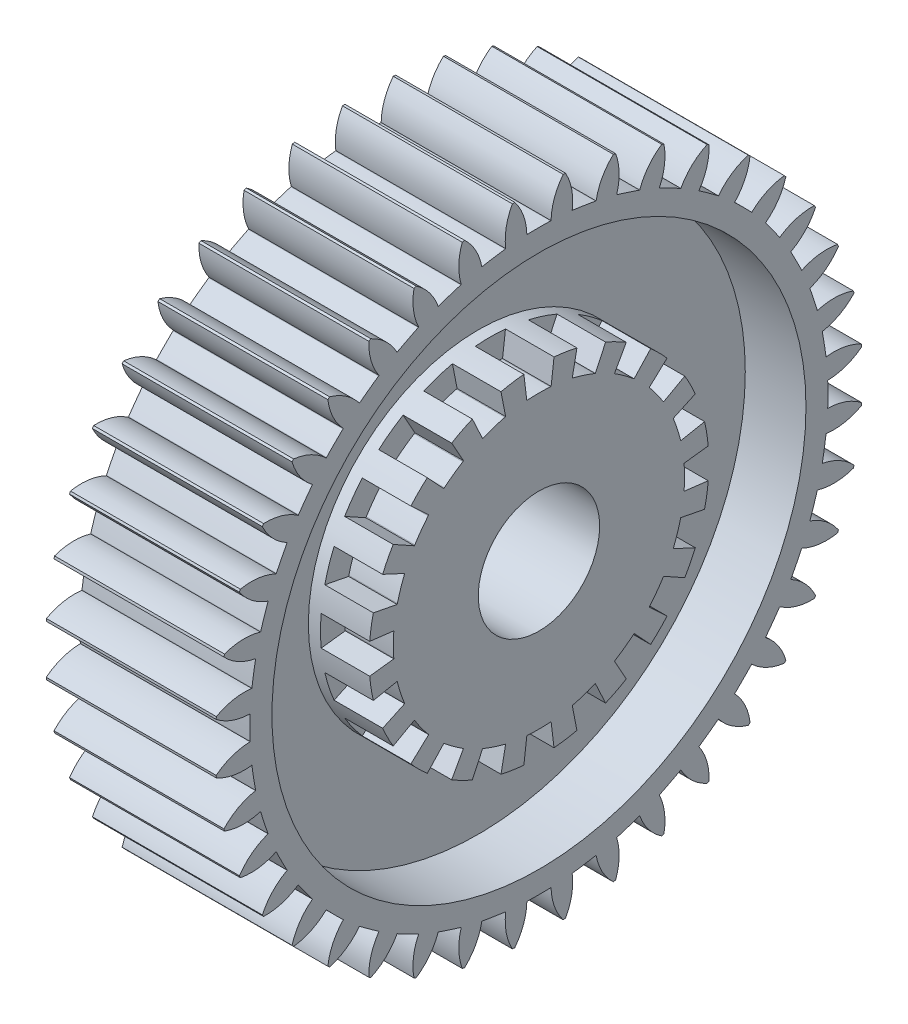
from build123d import *

# Parameters (mm, degrees)
SKETCH1_R                = 133.35
BOSS_EXTRUDE1_DEPTH      = 35
SKETCH2_R                = 25
CUT_EXTRUDE1_DEPTH       = 202.157761471
SKETCH3_R                = 110
SKETCH3_R_2              = 70
CUT_EXTRUDE2_DEPTH       = 25
CUT_EXTRUDE5_DEPTH       = 202.157761471
FILLET1_R                = 230
CIRPATTERN1_COUNT        = 40
FILLET1_OF_CIRPATTERN1_R = 230
CUT_EXTRUDE6_DEPTH       = 20
FILLET2_R                = 70
CIRPATTERN2_COUNT        = 20
FILLET2_OF_CIRPATTERN2_R = 70


with BuildPart() as part:
    # Sketch1 → Boss-Extrude1 (new, symmetric)
    with BuildSketch(Plane(origin=(0, 0, 0), x_dir=(0, 0, -1), z_dir=(1, 0, 0))):
        Circle(SKETCH1_R)
    extrude(amount=BOSS_EXTRUDE1_DEPTH, both=True)

    # Sketch2 → Cut-Extrude1 (cut, through all)
    with BuildSketch(Plane(origin=(35, 0, 0), x_dir=(0, 0, -1), z_dir=(1, 0, 0))):
        Circle(SKETCH2_R)
    extrude(amount=-CUT_EXTRUDE1_DEPTH, mode=Mode.SUBTRACT)

    # Sketch3 → Cut-Extrude2 (cut)
    with BuildSketch(Plane(origin=(35, 0, 0), x_dir=(0, 0, -1), z_dir=(1, 0, 0))):
        Circle(SKETCH3_R)
        Circle(SKETCH3_R_2, mode=Mode.SUBTRACT)
    extrude(amount=-CUT_EXTRUDE2_DEPTH, mode=Mode.SUBTRACT)

    # Sketch4 → Cut-Extrude5 (cut, through all)
    with BuildSketch(Plane(origin=(35, 0, 0), x_dir=(0, 0, -1), z_dir=(1, 0, 0))):
        with BuildLine():
            Line((0, 119.065), (-4.985, 118.960598519))
            ThreePointArc((-4.985, 118.960598519), (-6.345136479, 126.372539094), (-9.975, 132.976395932))
            Line((-9.975, 132.976395932), (0, 144.674504679))
            Line((0, 144.674504679), (9.975, 132.976395932))
            ThreePointArc((9.975, 132.976395932), (6.345136479, 126.372539094), (4.985, 118.960598519))
            Line((4.985, 118.960598519), (0, 119.065))
        make_face()
    cut_extrude5 = extrude(amount=-CUT_EXTRUDE5_DEPTH, mode=Mode.SUBTRACT)

    # Fillet1
    # the kernel refuses this fillet: 230 mm, written as the material it takes off along each edge
    with BuildSketch(Plane(origin=(47.042297206, 119.065, 0), x_dir=(0, -0.02093853410662844, -0.99978076486271), z_dir=(-1, 0, 0))) as fillet1_piece_1:
        with BuildLine():
            CenterArc((FILLET1_R * 0.0209431255756, FILLET1_R), FILLET1_R, 267.600445375, 2.399554625)
            Line((-FILLET1_R * 0.0209247617128, FILLET1_R * 0.000876844421069), (0, 0))
            Line((0, 0), (FILLET1_R * 0.0209431255756, 0))
        make_face()
    extrude(amount=94.084594412, mode=Mode.SUBTRACT)

    # CirPattern1: Cut-Extrude5 ×40 about axis
    cirpattern1_axis = Axis((0, 0, 0), (1, 0, 0))
    for i in range(1, CIRPATTERN1_COUNT):
        add(cut_extrude5.rotate(cirpattern1_axis, i * 360 / CIRPATTERN1_COUNT), mode=Mode.SUBTRACT)

    # Fillet1 of CirPattern1
    # the kernel refuses this fillet: 230 mm, written as the material it takes off along each edge
    with BuildSketch(Plane(origin=(47.042297206, 117.599112273, 18.62586958), x_dir=(0, -0.17708091511508742, 0.9841962962244896), z_dir=(-1, 0, 0)), Plane(origin=(47.042297206, 113.237544113, 36.793108435), x_dir=(0, -0.32886297629553746, 0.9443776484129858), z_dir=(-1, 0, 0)), Plane(origin=(47.042297206, 106.087691802, 54.054378851), x_dir=(0, -0.47254733956596195, 0.8813052886878253), z_dir=(-1, 0, 0)), Plane(origin=(47.042297206, 96.325608435, 69.984651064), x_dir=(0, -0.6045960190415535, 0.7965322678706152), z_dir=(-1, 0, 0)), Plane(origin=(47.042297206, 84.191668902, 84.191668902), x_dir=(0, -0.7217575379892, 0.6921459790793909), z_dir=(-1, 0, 0)), Plane(origin=(47.042297206, 69.984651064, 96.325608435), x_dir=(0, -0.821146990975616, 0.5707167591824261), z_dir=(-1, 0, 0)), Plane(origin=(47.042297206, 54.054378851, 106.087691802), x_dir=(0, -0.9003170798135939, 0.4352345985740596), z_dir=(-1, 0, 0)), Plane(origin=(47.042297206, 36.793108435, 113.237544113), x_dir=(0, -0.957318374165481, 0.2890355176879826), z_dir=(-1, 0, 0)), Plane(origin=(47.042297206, 18.62586958, 117.599112273), x_dir=(0, -0.9907473129878858, 0.13571942310253224), z_dir=(-1, 0, 0)), Plane(origin=(47.042297206, 0, 119.065), x_dir=(0, -0.99978076486271, -0.02093853410662844), z_dir=(-1, 0, 0)), Plane(origin=(47.042297206, -18.62586958, 117.599112273), x_dir=(0, -0.9841962962244893, -0.17708091511508778), z_dir=(-1, 0, 0)), Plane(origin=(47.042297206, -36.793108435, 113.237544113), x_dir=(0, -0.9443776484129849, -0.3288629762955401), z_dir=(-1, 0, 0)), Plane(origin=(47.042297206, -54.054378851, 106.087691802), x_dir=(0, -0.8813052886878283, -0.47254733956595685), z_dir=(-1, 0, 0)), Plane(origin=(47.042297206, -69.984651064, 96.325608435), x_dir=(0, -0.7965322678706152, -0.6045960190415535), z_dir=(-1, 0, 0)), Plane(origin=(47.042297206, -84.191668902, 84.191668902), x_dir=(0, -0.6921459790793895, -0.7217575379892014), z_dir=(-1, 0, 0)), Plane(origin=(47.042297206, -96.325608435, 69.984651064), x_dir=(0, -0.5707167591824215, -0.8211469909756194), z_dir=(-1, 0, 0)), Plane(origin=(47.042297206, -106.087691802, 54.054378851), x_dir=(0, -0.43523459857405905, -0.9003170798135942), z_dir=(-1, 0, 0)), Plane(origin=(47.042297206, -113.237544113, 36.793108435), x_dir=(0, -0.2890355176879803, -0.9573183741654817), z_dir=(-1, 0, 0)), Plane(origin=(47.042297206, -117.599112273, 18.62586958), x_dir=(0, -0.13571942310253213, -0.9907473129878858), z_dir=(-1, 0, 0)), Plane(origin=(47.042297206, -119.065, 0), x_dir=(0, 0.02093853410662844, -0.99978076486271), z_dir=(-1, 0, 0)), Plane(origin=(47.042297206, -117.599112273, -18.62586958), x_dir=(0, 0.17708091511509066, -0.984196296224489), z_dir=(-1, 0, 0)), Plane(origin=(47.042297206, -113.237544113, -36.793108435), x_dir=(0, 0.32886297629553435, -0.9443776484129867), z_dir=(-1, 0, 0)), Plane(origin=(47.042297206, -106.087691802, -54.054378851), x_dir=(0, 0.47254733956596195, -0.8813052886878253), z_dir=(-1, 0, 0)), Plane(origin=(47.042297206, -96.325608435, -69.984651064), x_dir=(0, 0.6045960190415582, -0.7965322678706116), z_dir=(-1, 0, 0)), Plane(origin=(47.042297206, -84.191668902, -84.191668902), x_dir=(0, 0.7217575379892043, -0.6921459790793865), z_dir=(-1, 0, 0)), Plane(origin=(47.042297206, -69.984651064, -96.325608435), x_dir=(0, 0.8211469909756152, -0.5707167591824276), z_dir=(-1, 0, 0)), Plane(origin=(47.042297206, -54.054378851, -106.087691802), x_dir=(0, 0.9003170798135955, -0.43523459857405605), z_dir=(-1, 0, 0)), Plane(origin=(47.042297206, -36.793108435, -113.237544113), x_dir=(0, 0.9573183741654809, -0.289035517687983), z_dir=(-1, 0, 0)), Plane(origin=(47.042297206, -18.62586958, -117.599112273), x_dir=(0, 0.9907473129878851, -0.13571942310253812), z_dir=(-1, 0, 0)), Plane(origin=(47.042297206, 0, -119.065), x_dir=(0, 0.9997807648627102, 0.02093853410662844), z_dir=(-1, 0, 0)), Plane(origin=(47.042297206, 18.62586958, -117.599112273), x_dir=(0, 0.9841962962244896, 0.17708091511508767), z_dir=(-1, 0, 0)), Plane(origin=(47.042297206, 36.793108435, -113.237544113), x_dir=(0, 0.9443776484129838, 0.3288629762955432), z_dir=(-1, 0, 0)), Plane(origin=(47.042297206, 54.054378851, -106.087691802), x_dir=(0, 0.8813052886878266, 0.47254733956595973), z_dir=(-1, 0, 0)), Plane(origin=(47.042297206, 69.984651064, -96.325608435), x_dir=(0, 0.7965322678706113, 0.6045960190415587), z_dir=(-1, 0, 0)), Plane(origin=(47.042297206, 84.191668902, -84.191668902), x_dir=(0, 0.6921459790793925, 0.7217575379891985), z_dir=(-1, 0, 0)), Plane(origin=(47.042297206, 106.087691802, -54.054378851), x_dir=(0, 0.43523459857405483, 0.9003170798135962), z_dir=(-1, 0, 0)), Plane(origin=(47.042297206, 113.237544113, -36.793108435), x_dir=(0, 0.289035517687983, 0.9573183741654809), z_dir=(-1, 0, 0)), Plane(origin=(47.042297206, 117.599112273, -18.62586958), x_dir=(0, 0.13571942310253812, 0.9907473129878851), z_dir=(-1, 0, 0))) as fillet1_of_cirpattern1_piece_1:
        with BuildLine():
            CenterArc((FILLET1_OF_CIRPATTERN1_R * 0.0209431255756, -FILLET1_OF_CIRPATTERN1_R), FILLET1_OF_CIRPATTERN1_R, 90, 2.399554625)
            Line((-FILLET1_OF_CIRPATTERN1_R * 0.0209247617128, -FILLET1_OF_CIRPATTERN1_R * 0.000876844421069), (0, 0))
            Line((0, 0), (FILLET1_OF_CIRPATTERN1_R * 0.0209431255756, 0))
        make_face()
    extrude(amount=94.084594412, mode=Mode.SUBTRACT)
    with BuildSketch(Plane(origin=(47.042297206, 96.325608435, -69.984651064), x_dir=(0, -0.6045960190415535, -0.7965322678706152), z_dir=(-1, 0, 0))) as fillet1_of_cirpattern1_piece_2:
        with BuildLine():
            CenterArc((FILLET1_OF_CIRPATTERN1_R * 0.0209431255756, FILLET1_OF_CIRPATTERN1_R), FILLET1_OF_CIRPATTERN1_R, 267.600445375, 2.399554625)
            Line((-FILLET1_OF_CIRPATTERN1_R * 0.0209247617128, FILLET1_OF_CIRPATTERN1_R * 0.000876844421069), (0, 0))
            Line((0, 0), (FILLET1_OF_CIRPATTERN1_R * 0.0209431255756, 0))
        make_face()
    extrude(amount=94.084594412, mode=Mode.SUBTRACT)

    # Sketch5 → Cut-Extrude6 (cut)
    with BuildSketch(Plane(origin=(35, 0, 0), x_dir=(0, 0, -1), z_dir=(1, 0, 0))):
        Polygon((-5, 59.791303716), (-9.364236352, 95.675227933), (9.364236352, 95.675227933), (5, 59.791303716), (0, 60.127275345), align=None)
    cut_extrude6 = extrude(amount=-CUT_EXTRUDE6_DEPTH, mode=Mode.SUBTRACT)

    # Fillet2
    fillet2_edges = [part.edges().sort_by_distance(p)[0] for p in [
        (25, 60.127275345, 0),
    ]]
    fillet(fillet2_edges, radius=FILLET2_R)

    # CirPattern2: Cut-Extrude6 ×20 about axis
    cirpattern2_axis = Axis((0, 0, 0), (1, 0, 0))
    for i in range(1, CIRPATTERN2_COUNT):
        add(cut_extrude6.rotate(cirpattern2_axis, i * 360 / CIRPATTERN2_COUNT), mode=Mode.SUBTRACT)

    # Fillet2 of CirPattern2
    fillet2_of_cirpattern2_edges = [part.edges().sort_by_distance(p)[0] for p in [
        (25, 57.184437023, 18.580349907),
        (25, 48.643987579, 35.341925708),
        (25, 35.341925708, 48.643987579),
        (25, 18.580349907, 57.184437023),
        (25, 0, 60.127275345),
        (25, -18.580349907, 57.184437023),
        (25, -35.341925708, 48.643987579),
        (25, -48.643987579, 35.341925708),
        (25, -57.184437023, 18.580349907),
        (25, -60.127275345, 0),
        (25, -57.184437023, -18.580349907),
        (25, -48.643987579, -35.341925708),
        (25, -35.341925708, -48.643987579),
        (25, -18.580349907, -57.184437023),
        (25, 0, -60.127275345),
        (25, 18.580349907, -57.184437023),
        (25, 35.341925708, -48.643987579),
        (25, 48.643987579, -35.341925708),
        (25, 57.184437023, -18.580349907),
    ]]
    fillet(fillet2_of_cirpattern2_edges, radius=FILLET2_OF_CIRPATTERN2_R)


solid = part.part
